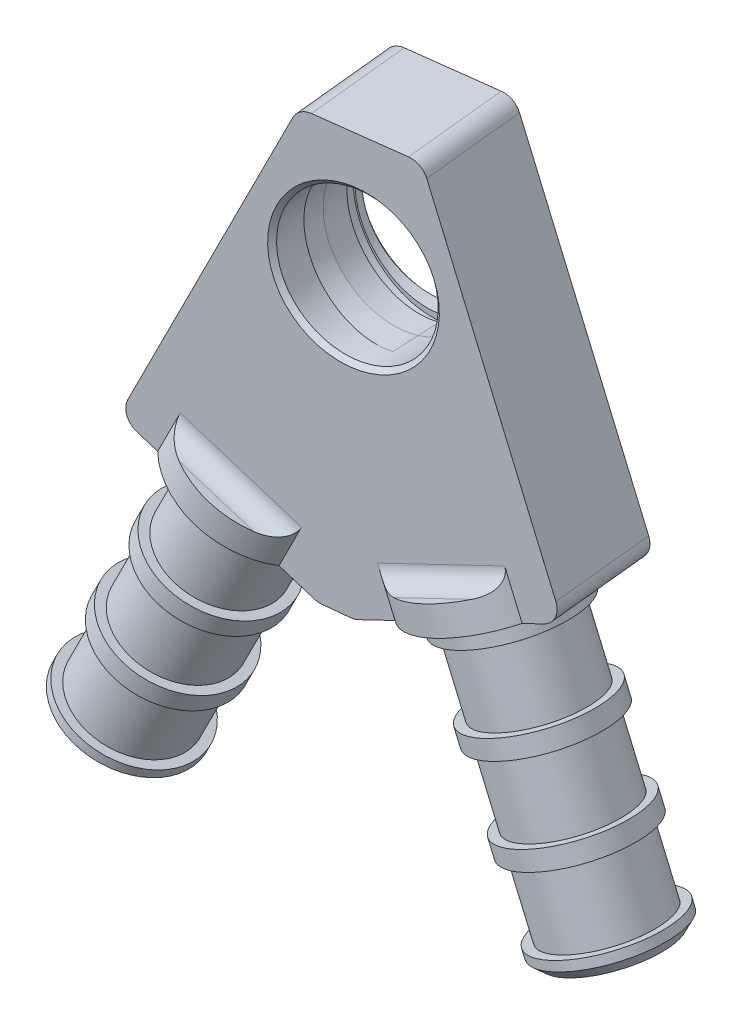
from build123d import *

# Parameters (mm, degrees)
SKETCH1_R               = 8
BOSS_EXTRUDE1_DEPTH     = 6
FILLET1_R               = 2
SKETCH2_R               = 9
BOSS_EXTRUDE2_DEPTH     = 3
SKETCH4_R               = 6
BOSS_EXTRUDE4_DEPTH     = 31
SKETCH7_R               = 7
SKETCH7_R_2             = 6
BOSS_EXTRUDE5_DEPTH     = 2
LPATTERN1_COUNT         = 4
LPATTERN1_PITCH         = 9.666666667
CHAMFER1_SIZE           = 1
SKETCH10_R              = 9
BOSS_EXTRUDE6_DEPTH     = 3
SKETCH11_R              = 6
BOSS_EXTRUDE7_DEPTH     = 31
SKETCH12_R              = 7
SKETCH12_R_2            = 6
BOSS_EXTRUDE8_DEPTH     = 2
LPATTERN2_COUNT         = 4
LPATTERN2_PITCH         = 9.666666667
CHAMFER2_SIZE           = 1
FILLET2_R               = 2
CHAMFER3_SIZE           = 0.5
CUT_EXTRUDE1_DEPTH      = 3
CUT_EXTRUDE1_DEPTH_BACK = 2
SKETCH14_R              = 8
CUT_EXTRUDE2_START      = -2.5
SKETCH15_R              = 8.75
CUT_EXTRUDE2_DEPTH      = 1.05


with BuildPart() as part:
    # Sketch1 → Boss-Extrude1 (new, symmetric)
    with BuildSketch(Plane(origin=(40.22848605, 10.507440386, 304.215416897), x_dir=(0.9913798815676159, -0.004522624098671365, -0.13094073580915158), z_dir=(0.13101881705686366, 0.03422133281336, 0.9907890643106118))):
        Polygon((1125.792356894, 582.460946507), (1113.558101773, 582.460946507), (1096.881335877, 546.245672675), (1116.864407815, 537.043670941), (1120.493097753, 536.959213567), (1140.882650237, 545.221546742), align=None)
        with Locations((1119.421056028, 568.89431536)):
            Circle(SKETCH1_R, mode=Mode.SUBTRACT)
    extrude(amount=BOSS_EXTRUDE1_DEPTH, both=True)

    # Fillet1
    fillet1_edges = [part.edges().sort_by_distance(p)[0] for p in [
        (1171.276592724, 550.244276551, 136.006960752),
        (1151.062800598, 542.079081631, 138.961990325),
        (1147.465390397, 542.179899873, 139.434218281),
        (1127.654574905, 551.466793556, 141.733173541),
        (1156.316379498, 587.529731054, 136.697432132),
        (1144.187585105, 587.585061991, 138.2993945),
    ]]
    fillet(fillet1_edges, radius=FILLET1_R)

    # Sketch2 → Boss-Extrude2 (add)
    with BuildSketch(Plane(origin=(395.991584625, 865.08930795, -82.244406037), x_dir=(-0.9099731182582202, 0.41280589206970897, -0.03924563058409188), z_dir=(-0.41466724496566065, -0.9058884428480648, 0.08612319703132973))):
        with Locations((-814.93440097, -191.706014946)):
            Circle(SKETCH2_R)
    extrude(amount=-BOSS_EXTRUDE2_DEPTH)

    # Sketch4 → Boss-Extrude4 (add)
    with BuildSketch(Plane(origin=(395.991584625, 865.08930795, -82.244406037), x_dir=(-0.9099731182582202, 0.41280589206970897, -0.03924563058409188), z_dir=(-0.41466724496566065, -0.9058884428480648, 0.08612319703132973))):
        with Locations((-814.93440097, -191.706014946)):
            Circle(SKETCH4_R)
    extrude(amount=BOSS_EXTRUDE4_DEPTH)

    # Sketch7 → Boss-Extrude5 (add)
    with BuildSketch(Plane(origin=(395.991584625, 865.08930795, -82.244406037), x_dir=(-0.9099731182582202, 0.41280589206970897, -0.03924563058409188), z_dir=(-0.41466724496566065, -0.9058884428480648, 0.08612319703132973))):
        with Locations((-814.93440097, -191.706014946)):
            Circle(SKETCH7_R)
        with Locations((-814.93440097, -191.706014946)):
            Circle(SKETCH7_R_2, mode=Mode.SUBTRACT)
    boss_extrude5 = extrude(amount=BOSS_EXTRUDE5_DEPTH)

    # LPattern1: Boss-Extrude5 ×4
    with Locations(*[Vector(-0.41466724496566276, -0.9058884428480639, 0.08612319703133002) * (i * LPATTERN1_PITCH) for i in range(1, LPATTERN1_COUNT)]):
        add(boss_extrude5)

    # Chamfer1
    chamfer1_edges = [part.edges().sort_by_distance(p)[0] for p in [
        (1131.075109885, 515.851163742, 143.528234433),
    ]]
    chamfer(chamfer1_edges, length=CHAMFER1_SIZE)

    # Sketch9 → Cut-Revolve1 (revolve, cut)
    with BuildSketch(Plane(origin=(701.339911976, -328.773401621, -81.387314949), x_dir=(0.09461756399583972, -0.04435472420271057, 0.9945251002485532), z_dir=(-0.900491613247789, 0.42213153103599016, 0.10449796637066838))):
        with BuildLine():
            Line((225.877486563, 947.080484482), (230.360581849, 947.470172371))
            Line((230.360581849, 947.470172371), (228.513172599, 968.723364841))
            ThreePointArc((228.513172599, 968.723364841), (226.924553441, 971.779254978), (223.640389423, 972.816772239))
            Line((223.640389423, 972.816772239), (225.877486563, 947.080484482))
        make_face()
    revolve(axis=Axis((1135.417535219, 542.142923093, 141.028665762), (-0.41466724496565976, -0.9058884428480652, 0.08612319703132981)), mode=Mode.SUBTRACT)

    # Sketch10 → Boss-Extrude6 (add)
    with BuildSketch(Plane(origin=(-28.609160219, 71.302830085, 1.320422779), x_dir=(-0.9281031291481225, -0.3722593970186158, -0.006893692537381721), z_dir=(0.3723232220335758, -0.9279440302990668, -0.017184148709241842))):
        with Locations((-1281.946821979, -127.348536073)):
            Circle(SKETCH10_R)
    extrude(amount=-BOSS_EXTRUDE6_DEPTH)

    # Sketch11 → Boss-Extrude7 (add)
    with BuildSketch(Plane(origin=(-28.609160219, 71.302830085, 1.320422779), x_dir=(-0.9281031291481225, -0.3722593970186158, -0.006893692537381721), z_dir=(0.3723232220335758, -0.9279440302990668, -0.017184148709241842))):
        with Locations((-1281.946821979, -127.348536073)):
            Circle(SKETCH11_R)
    extrude(amount=BOSS_EXTRUDE7_DEPTH)

    # Sketch12 → Boss-Extrude8 (add)
    with BuildSketch(Plane(origin=(-28.609160219, 71.302830085, 1.320422779), x_dir=(-0.9281031291481225, -0.3722593970186158, -0.006893692537381721), z_dir=(0.3723232220335758, -0.9279440302990668, -0.017184148709241842))):
        with Locations((-1281.946821979, -127.348536073)):
            Circle(SKETCH12_R)
        with Locations((-1281.946821979, -127.348536073)):
            Circle(SKETCH12_R_2, mode=Mode.SUBTRACT)
    boss_extrude8 = extrude(amount=BOSS_EXTRUDE8_DEPTH)

    # LPattern2: Boss-Extrude8 ×4
    with Locations(*[Vector(0.3723232220335758, -0.9279440302990668, -0.017184148709241846) * (i * LPATTERN2_PITCH) for i in range(1, LPATTERN2_COUNT)]):
        add(boss_extrude8)

    # Chamfer2
    chamfer2_edges = [part.edges().sort_by_distance(p)[0] for p in [
        (1179.208438448, 520.001229931, 137.000022776),
    ]]
    chamfer(chamfer2_edges, length=CHAMFER2_SIZE)

    # Sketch13 → Cut-Revolve2 (revolve, cut)
    with BuildSketch(Plane(origin=(1149.55037083, 464.35140862, -168.051364138), x_dir=(0.37232322203357693, -0.9279440302990664, -0.01718414870924198), z_dir=(0.9188087330405366, 0.37114522361577396, -0.1343195260401155))):
        with BuildLine():
            Line((-45.839580575, -307.043575525), (-45.839580575, -302.543575525))
            Line((-45.839580575, -302.543575525), (-67.172913908, -302.543575525))
            ThreePointArc((-67.172913908, -302.543575525), (-70.354894424, -303.86159501), (-71.672913908, -307.043575525))
            Line((-71.672913908, -307.043575525), (-45.839580575, -307.043575525))
        make_face()
    revolve(axis=Axis((1163.093366642, 541.367301601, 137.39569077), (0.37232322203357254, -0.927944030299068, -0.017184148709241166)), mode=Mode.SUBTRACT)

    # Fillet2
    fillet2_edges = [part.edges().sort_by_distance(p)[0] for p in [
        (1159.266614093, 548.740183185, 131.591293599),
        (1138.017871484, 549.335684046, 134.380591934),
        (1160.838839897, 549.150839179, 143.480762371),
        (1139.590097288, 549.74634004, 146.270060706),
    ]]
    fillet(fillet2_edges, radius=FILLET2_R)

    # Chamfer3
    chamfer3_edges = [part.edges().sort_by_distance(p)[0] for p in [
        (1142.85507385, 574.24150899, 144.992260272),
        (1141.282848045, 573.830852996, 133.102791501),
    ]]
    chamfer(chamfer3_edges, length=CHAMFER3_SIZE)

    # Sketch14 → Cut-Extrude1 (cut, two sides: drawn at the far end of the back side and taken through both)
    with BuildSketch(Plane.XY.offset(138).offset(-CUT_EXTRUDE1_DEPTH_BACK)):
        with Locations((1150, 574)):
            Circle(SKETCH14_R)
    extrude(amount=CUT_EXTRUDE1_DEPTH + CUT_EXTRUDE1_DEPTH_BACK, mode=Mode.SUBTRACT)

    # Sketch15 → Cut-Extrude2 (cut)
    with BuildSketch(Plane.XY.offset(138).offset(CUT_EXTRUDE2_START)):
        with Locations((1150, 574)):
            Circle(SKETCH15_R)
    extrude(amount=-CUT_EXTRUDE2_DEPTH, mode=Mode.SUBTRACT)


solid = part.part
